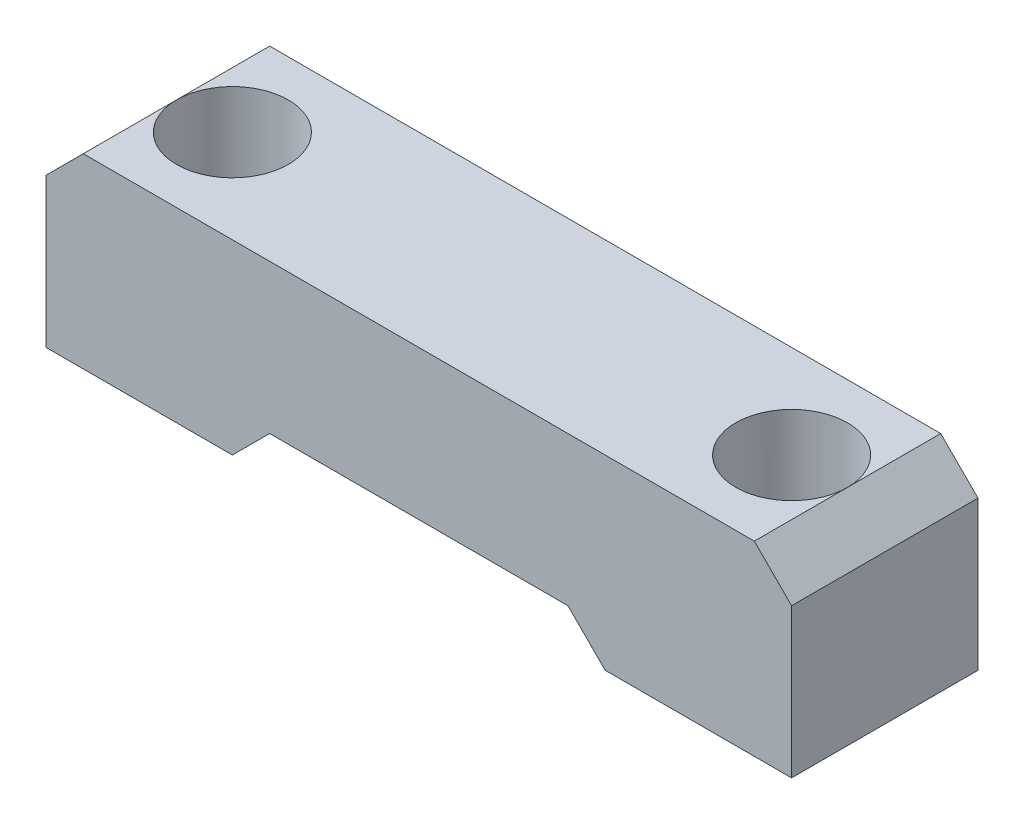
from build123d import *

# Parameters (mm, degrees)
EXTRUDE_1_DEPTH   = 2.5
MM_1_D            = 3
CHAMFER_START     = -3
CHAMFER_1_DEPTH   = 6
CHAMFER_START_2   = -2.5
CHAMFER_1_2_DEPTH = 5


with BuildPart() as part:
    # 草图1 → 凸台-拉伸1 (new, symmetric)
    with BuildSketch(Plane.XY):
        Polygon((5, 0), (10, 0), (10, 5), (-10, 5), (-10, 0), (-5, 0), (-5, 1), (5, 1), align=None)
    extrude(amount=EXTRUDE_1_DEPTH, both=True)

    # 大小mm 暗销孔1 (through all)
    with Locations(Plane(origin=(0, 5, 0), x_dir=(1, 0, 0), z_dir=(0, 1, 0))):
        with Locations((-7.5, 0), (7.5, 0)):
            Hole(MM_1_D / 2)

    # 倒角1: read off the stored shape, not the designer's step
    # 倒角1 outline → 倒角1 (cut)
    with BuildSketch(Plane.XY.offset(CHAMFER_START)):
        Polygon((10, 5), (9, 5), (10, 4), align=None)
        Polygon((-10, 4), (-9, 5), (-10, 5), align=None)
    extrude(amount=CHAMFER_1_DEPTH, mode=Mode.SUBTRACT)

    # Chamfer 1 2 outline → Chamfer 1 2 (add)
    with BuildSketch(Plane.XY.offset(CHAMFER_START_2)):
        Polygon((5, 1), (4, 1), (5, 0), align=None)
        Polygon((-5, 0), (-4, 1), (-5, 1), align=None)
    extrude(amount=CHAMFER_1_2_DEPTH)


solid = part.part
